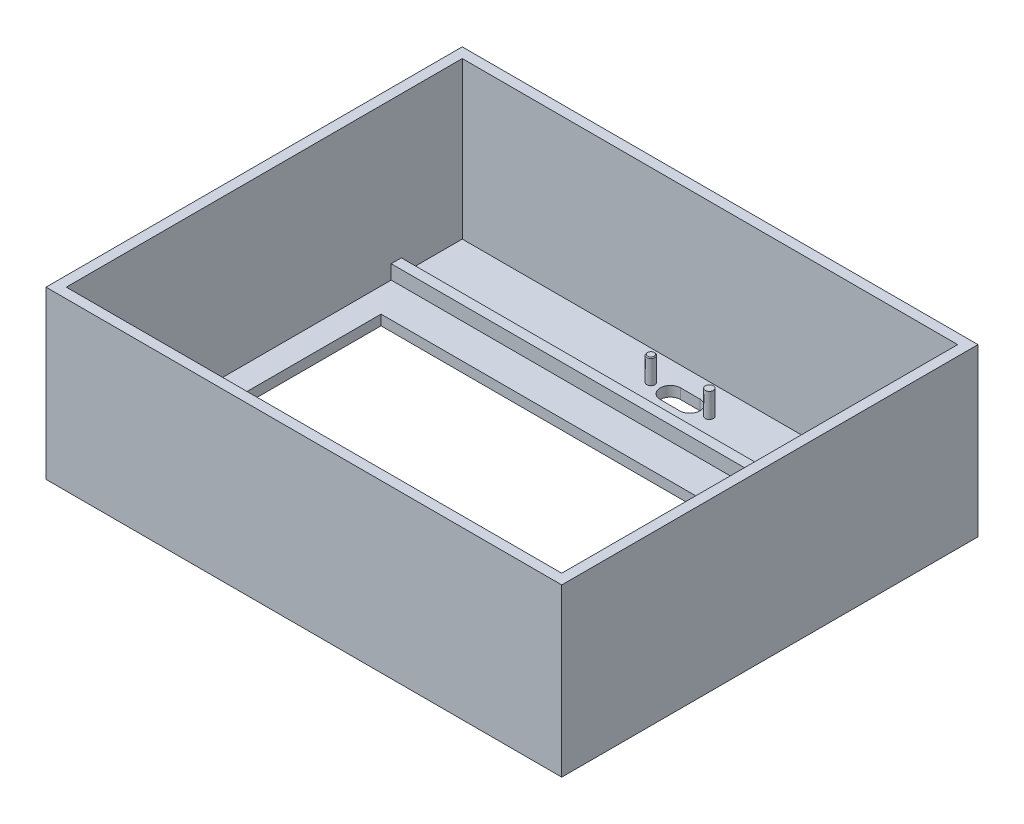
from build123d import *

# Parameters (mm, degrees)
SKETCH1_W           = 127
SKETCH1_H           = 85
BOSS_EXTRUDE1_DEPTH = 2.5
SKETCH2_W           = 127
SKETCH2_H           = 85
SKETCH2_W_2         = 122
SKETCH2_H_2         = 80
BOSS_EXTRUDE2_DEPTH = 38.5
SKETCH3_W           = 110
SKETCH3_H           = 68.5
CUT_EXTRUDE1_DEPTH  = 2.5
BOSS_EXTRUDE3_DEPTH = 15
SKETCH10_W          = 122
SKETCH10_H          = 2.5
CUT_EXTRUDE2_DEPTH  = 35
SKETCH11_W          = 127
SKETCH11_H          = 41
BOSS_EXTRUDE4_DEPTH = 2.5
CUT_EXTRUDE4_DEPTH  = 2.5
SKETCH14_W          = 15
SKETCH14_H          = 1
CUT_EXTRUDE5_DEPTH  = 1.5
SKETCH13_R          = 1
BOSS_EXTRUDE6_DEPTH = 6
CHAMFER1_SIZE       = 0.2


with BuildPart() as part:
    # Sketch1 → Boss-Extrude1 (new body)
    with BuildSketch(Plane(origin=(0, 0, 0), x_dir=(1, 0, 0), z_dir=(0, 1, 0))):
        with Locations((63.5, 42.5)):
            Rectangle(SKETCH1_W, SKETCH1_H)
    extrude(amount=BOSS_EXTRUDE1_DEPTH)

    # Sketch2 → Boss-Extrude2 (add)
    with BuildSketch(Plane(origin=(0, 2.5, 0), x_dir=(1, 0, 0), z_dir=(0, 1, 0))):
        with Locations((63.5, 42.5)):
            Rectangle(SKETCH2_W, SKETCH2_H)
        with Locations((63.5, 42.5)):
            Rectangle(SKETCH2_W_2, SKETCH2_H_2, mode=Mode.SUBTRACT)
    extrude(amount=BOSS_EXTRUDE2_DEPTH)

    # Sketch3 → Cut-Extrude1 (cut)
    with BuildSketch(Plane(origin=(0, 0, 0), x_dir=(-1, 0, 0), z_dir=(0, -1, 0))):
        with Locations((-63.5, 39.75)):
            Rectangle(SKETCH3_W, SKETCH3_H)
    extrude(amount=-CUT_EXTRUDE1_DEPTH, mode=Mode.SUBTRACT)

    # Sketch9 → Boss-Extrude3 (add)
    with BuildSketch(Plane(origin=(0, 0, -85), x_dir=(-1, 0, 0), z_dir=(0, 0, -1))):
        Polygon((-127, 0), (0, 0), (0, 2.5), (0, 41), (-2.5, 41), (-2.5, 2.5), (-124.5, 2.5), (-124.5, 41), (-127, 41), (-127, 2.5), align=None)
    extrude(amount=BOSS_EXTRUDE3_DEPTH)

    # Sketch10 → Cut-Extrude2 (cut)
    with BuildSketch(Plane(origin=(0, 41, 0), x_dir=(1, 0, 0), z_dir=(0, 1, 0))):
        with Locations((63.5, 83.75)):
            Rectangle(SKETCH10_W, SKETCH10_H)
    extrude(amount=-CUT_EXTRUDE2_DEPTH, mode=Mode.SUBTRACT)

    # Sketch11 → Boss-Extrude4 (add)
    with BuildSketch(Plane(origin=(0, 0, -100), x_dir=(-1, 0, 0), z_dir=(0, 0, -1))):
        with Locations((-63.5, 20.5)):
            Rectangle(SKETCH11_W, SKETCH11_H)
    extrude(amount=BOSS_EXTRUDE4_DEPTH)

    # Sketch6 → Cut-Extrude4 (cut)
    with BuildSketch(Plane(origin=(0, 0, 0), x_dir=(-1, 0, 0), z_dir=(0, -1, 0))):
        with BuildLine():
            Line((-61.1, 90.153713072), (-65.9, 90.153713072))
            ThreePointArc((-65.9, 90.153713072), (-68.4, 92.653713072), (-65.9, 95.153713072))
            Line((-65.9, 95.153713072), (-61.1, 95.153713072))
            ThreePointArc((-61.1, 95.153713072), (-58.6, 92.653713072), (-61.1, 90.153713072))
        make_face()
    extrude(amount=-CUT_EXTRUDE4_DEPTH, mode=Mode.SUBTRACT)

    # Sketch14 → Cut-Extrude5 (cut)
    with BuildSketch(Plane(origin=(0, 2.5, 0), x_dir=(1, 0, 0), z_dir=(0, 1, 0))):
        with Locations((63.5, 86.653713072)):
            Rectangle(SKETCH14_W, SKETCH14_H)
    extrude(amount=-CUT_EXTRUDE5_DEPTH, mode=Mode.SUBTRACT)

    # Sketch13 → Boss-Extrude6 (add)
    with BuildSketch(Plane(origin=(0, 2.5, 0), x_dir=(1, 0, 0), z_dir=(0, 1, 0))):
        with Locations((56.3, 92.653713072)):
            Circle(SKETCH13_R)
        with Locations((70.7, 92.653713072)):
            Circle(SKETCH13_R)
    extrude(amount=BOSS_EXTRUDE6_DEPTH)

    # Chamfer1
    chamfer1_edges = [part.edges().sort_by_distance(p)[0] for p in [
        (55.3, 8.5, -92.653713072),
    ]]
    chamfer(chamfer1_edges, length=CHAMFER1_SIZE)


solid = part.part
